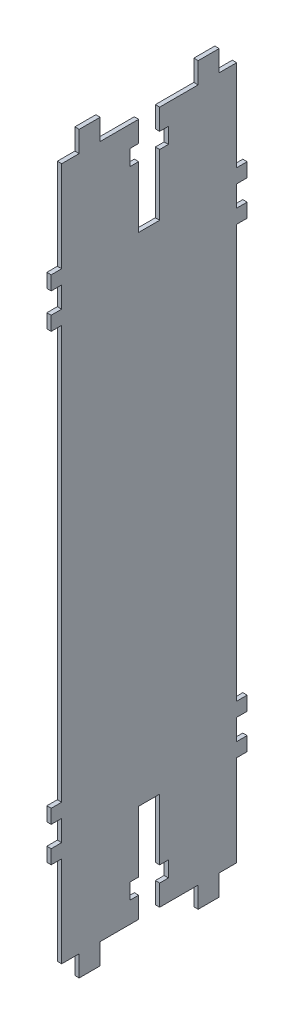
from build123d import *

# Parameters (mm, degrees)
BOSS_EXTRUDE1_DEPTH = 3


with BuildPart() as part:
    # Sketch1 → Boss-Extrude1 (new body)
    with BuildSketch(Plane(origin=(0, 0, 0), x_dir=(0, 0, -1), z_dir=(1, 0, 0))):
        Polygon((-60.50045, -152.46285), (-60.50045, -166.98295), (-67.76045, -166.98295), (-67.76045, -176.66235), (-60.50045, -176.66235), (-60.50045, -239.58145), (-48.39985, -239.58145), (-48.39985, -254.10145), (-33.88145, -254.10145), (-33.88145, -239.58145), (-7.26925, -239.58145), (-7.26925, -225.06305), (-13.31695, -225.06305), (-13.31695, -214.20305), (-7.26925, -214.20305), (-7.26925, -171.82185), (7.25255, -171.82185), (7.25255, -214.20305), (13.31025, -214.20305), (13.31025, -225.06305), (7.25255, -225.06305), (7.25255, -239.58145), (33.87975, -239.58145), (33.87975, -254.10145), (48.40145, -254.10145), (48.40145, -239.58145), (60.50045, -239.58145), (60.50045, -176.66235), (67.76045, -176.66235), (67.76045, -166.98295), (60.50045, -166.98295), (60.50045, -152.46285), (67.76045, -152.46285), (67.76045, -142.78345), (60.50045, -142.78345), (60.50045, 142.78005), (67.76045, 142.78005), (67.76045, 152.46125), (60.50045, 152.46125), (60.50045, 166.98125), (67.76045, 166.98125), (67.76045, 176.66235), (60.50045, 176.66235), (60.50045, 239.57975), (48.40145, 239.57975), (48.40145, 254.10145), (33.87975, 254.10145), (33.87975, 239.57975), (7.25255, 239.57975), (7.25255, 225.06305), (13.31025, 225.06305), (13.31025, 214.21475), (7.25255, 214.21475), (7.25255, 171.82185), (-7.26925, 171.82185), (-7.26925, 214.21475), (-13.31695, 214.21475), (-13.31695, 225.06305), (-7.26925, 225.06305), (-7.26925, 239.57975), (-33.88145, 239.57975), (-33.88145, 254.10145), (-48.39985, 254.10145), (-48.39985, 239.57975), (-60.50045, 239.57975), (-60.50045, 176.66235), (-67.76045, 176.66235), (-67.76045, 166.98125), (-60.50045, 166.98125), (-60.50045, 152.46125), (-67.76045, 152.46125), (-67.76045, 142.78005), (-60.50045, 142.78005), (-60.50045, -142.78345), (-67.76045, -142.78345), (-67.76045, -152.46285), align=None)
    extrude(amount=BOSS_EXTRUDE1_DEPTH)


solid = part.part
